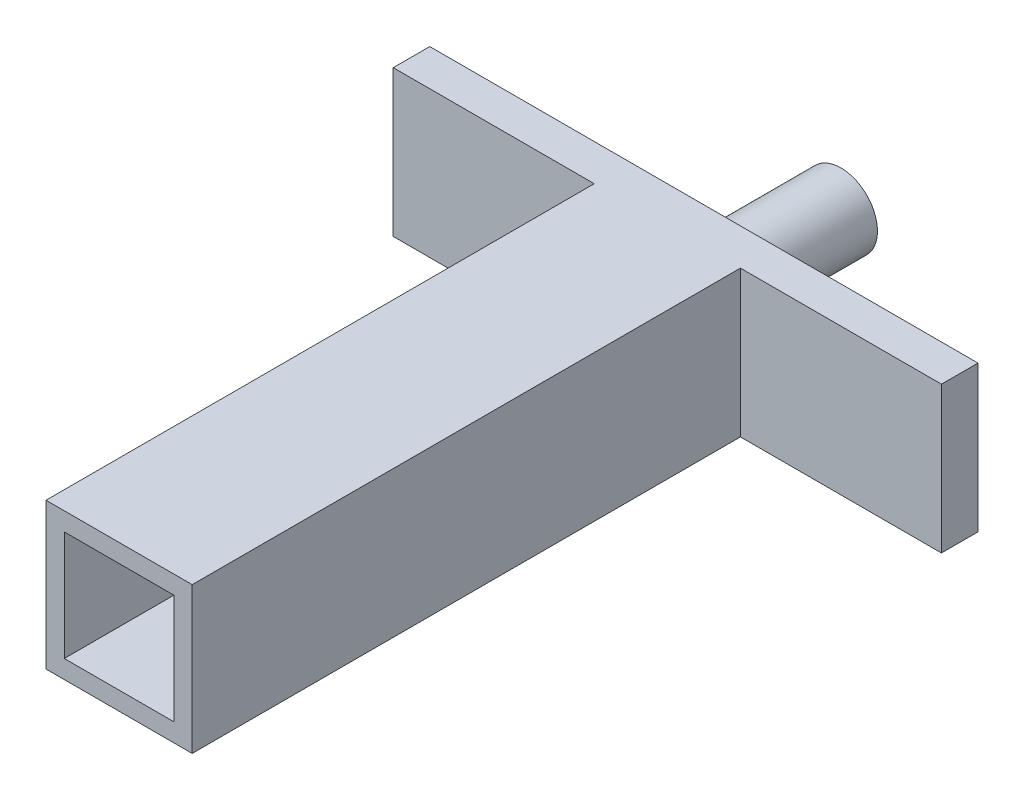
from build123d import *

# Parameters (mm, degrees)
SKETCH_8_W      = 4
SKETCH_8_H      = 4
EXTRUDE_5_DEPTH = 16
SHELL_2_T       = -0.5
SKETCH_9_R      = 1
EXTRUDE_6_DEPTH = 3.7
SKETCH_10_R     = 1
SKETCH_10_R_2   = 0.849026748
EXTRUDE_7_DEPTH = 0.05
SKETCH_11_W     = 5.5
SKETCH_11_H     = 4
EXTRUDE_8_DEPTH = 1


with BuildPart() as part:
    # Эскиз8 → Бобышка-Вытянуть5 (new body)
    with BuildSketch(Plane.XY):
        Rectangle(SKETCH_8_W, SKETCH_8_H)
    extrude(amount=EXTRUDE_5_DEPTH)

    # Оболочка2
    shell_2_openings = [part.faces().sort_by_distance(p)[0] for p in [
        (0, 0, 16),
    ]]
    offset(amount=SHELL_2_T, openings=shell_2_openings, kind=Kind.INTERSECTION)

    # Эскиз9 → Бобышка-Вытянуть6 (add)
    with BuildSketch(Plane(origin=(0, 0, 0), x_dir=(-1, 0, 0), z_dir=(0, 0, -1))):
        Circle(SKETCH_9_R)
    extrude(amount=EXTRUDE_6_DEPTH)

    # Эскиз10 → Бобышка-Вытянуть7 (add)
    # profile 1 of 2: a face of its own
    with BuildSketch(Plane(origin=(0, 0, -3.7), x_dir=(-1, 0, 0), z_dir=(0, 0, -1))):
        Circle(SKETCH_10_R)
        Circle(SKETCH_10_R_2, mode=Mode.SUBTRACT)
    # profile 2 of 2: a face of its own
    with BuildSketch(Plane(origin=(0, 0, -3.7), x_dir=(-1, 0, 0), z_dir=(0, 0, -1))):
        with BuildLine():
            Line((0, 0.556564641), (0, -0.556564641))
            ThreePointArc((0, -0.556564641), (0.047474291, -0.655228966), (0.15419684, -0.679698432))
            ThreePointArc((0.15419684, -0.679698432), (0.6969696, 0), (0.15419684, 0.679698432))
            ThreePointArc((0.15419684, 0.679698432), (0.047474291, 0.655228966), (0, 0.556564641))
        make_face()
    extrude(amount=EXTRUDE_7_DEPTH)

    # Эскиз11 → Бобышка-Вытянуть8 (add)
    with BuildSketch(Plane(origin=(0, 0, 0), x_dir=(-1, 0, 0), z_dir=(0, 0, -1))):
        with Locations((-4.75, 0)):
            Rectangle(SKETCH_11_W, SKETCH_11_H)
        with Locations((4.75, 0)):
            Rectangle(SKETCH_11_W, SKETCH_11_H)
    extrude(amount=-EXTRUDE_8_DEPTH)


solid = part.part
